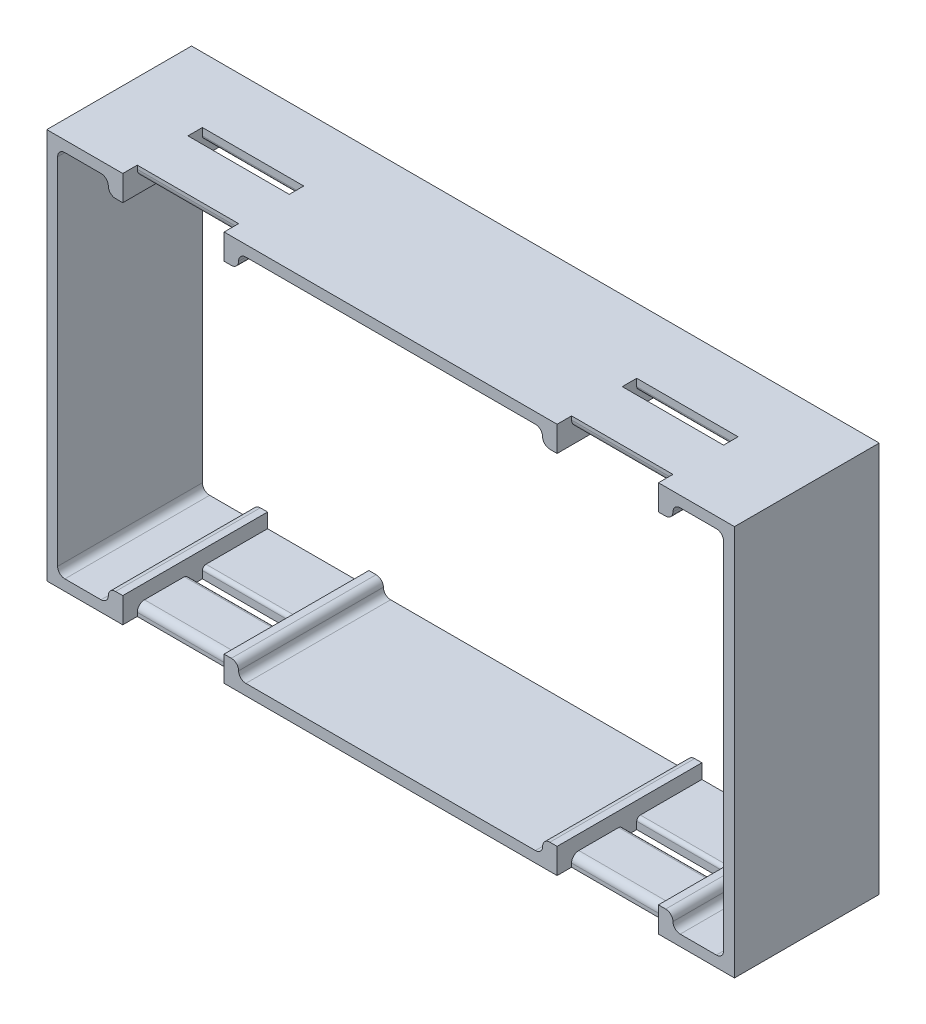
from build123d import *

# Parameters (mm, degrees)
SKETCH1_W               = 95
SKETCH1_H               = 54
SKETCH1_W_2             = 92
SKETCH1_H_2             = 51
BOSS_EXTRUDE1_DEPTH     = 20
SKETCH2_W               = 2
SKETCH2_H               = 2
BOSS_EXTRUDE2_DEPTH     = 20
FILLET1_R               = 1
CUT_EXTRUDE1_DEPTH      = 75.647504982
CUT_EXTRUDE1_DEPTH_BACK = 75.647504982
SKETCH3_W               = 14
SKETCH3_H               = 2
FILLET2_R               = 1
FILLET3_R               = 0.5


with BuildPart() as part:
    # Sketch1 → Boss-Extrude1 (new body)
    with BuildSketch(Plane.XY):
        Rectangle(SKETCH1_W, SKETCH1_H)
        Rectangle(SKETCH1_W_2, SKETCH1_H_2, mode=Mode.SUBTRACT)
    extrude(amount=BOSS_EXTRUDE1_DEPTH)

    # Sketch2 → Boss-Extrude2 (add)
    with BuildSketch(Plane(origin=(0, 0, 0), x_dir=(-1, 0, 0), z_dir=(0, 0, -1))):
        with Locations((22, 24.5)):
            Rectangle(SKETCH2_W, SKETCH2_H)
        with Locations((-38, 24.5)):
            Rectangle(SKETCH2_W, SKETCH2_H)
        with Locations((38, 24.5)):
            Rectangle(SKETCH2_W, SKETCH2_H)
        with Locations((-22, 24.5)):
            Rectangle(SKETCH2_W, SKETCH2_H)
        with Locations((38, -24.5)):
            Rectangle(SKETCH2_W, SKETCH2_H)
        with Locations((22, -24.5)):
            Rectangle(SKETCH2_W, SKETCH2_H)
        with Locations((-22, -24.5)):
            Rectangle(SKETCH2_W, SKETCH2_H)
        with Locations((-38, -24.5)):
            Rectangle(SKETCH2_W, SKETCH2_H)
    extrude(amount=-BOSS_EXTRUDE2_DEPTH)

    # Fillet1
    fillet1_edges = [part.edges().sort_by_distance(p)[0] for p in [
        (-46, -25.5, 10),
        (-46, 25.5, 10),
        (46, -25.5, 10),
        (39, -25.5, 10),
        (39, -23.5, 10),
        (21, -23.5, 10),
        (21, -25.5, 10),
        (-21, -25.5, 10),
        (-21, -23.5, 10),
        (-39, -23.5, 10),
        (-39, -25.5, 10),
        (-39, 25.5, 10),
        (-39, 23.5, 10),
        (-21, 23.5, 10),
        (-21, 25.5, 10),
        (21, 25.5, 10),
        (21, 23.5, 10),
        (39, 23.5, 10),
        (39, 25.5, 10),
        (46, 25.5, 10),
    ]]
    fillet(fillet1_edges, radius=FILLET1_R - 0.0001)  # a hair under: the kernel refuses the full size

    # Sketch3 → Cut-Extrude1 (cut, two sides: drawn at the far end of the back side and taken through both)
    with BuildSketch(Plane.XZ.offset(27).offset(-CUT_EXTRUDE1_DEPTH_BACK)):
        with Locations((-30, 10)):
            Rectangle(SKETCH3_W, SKETCH3_H)
        with Locations((30, 10)):
            Rectangle(SKETCH3_W, SKETCH3_H)
        with Locations((30, 19)):
            Rectangle(SKETCH3_W, SKETCH3_H)
        with Locations((-30, 19)):
            Rectangle(SKETCH3_W, SKETCH3_H)
    extrude(amount=CUT_EXTRUDE1_DEPTH + CUT_EXTRUDE1_DEPTH_BACK, mode=Mode.SUBTRACT)

    # Fillet2
    fillet2_edges = [part.edges().sort_by_distance(p)[0] for p in [
        (-30, -25.5, 18),
        (-30, 25.5, 18),
        (30, -25.5, 18),
        (30, 25.5, 18),
    ]]
    fillet(fillet2_edges, radius=FILLET2_R)

    # Fillet3
    fillet3_edges = [part.edges().sort_by_distance(p)[0] for p in [
        (30, -25.5, 9),
        (30, 25.5, 9),
        (30, -25.5, 11),
        (30, 25.5, 11),
        (-30, -25.5, 11),
        (-30, 25.5, 11),
        (-30, -25.5, 9),
        (-30, 25.5, 9),
    ]]
    fillet(fillet3_edges, radius=FILLET3_R)


solid = part.part
